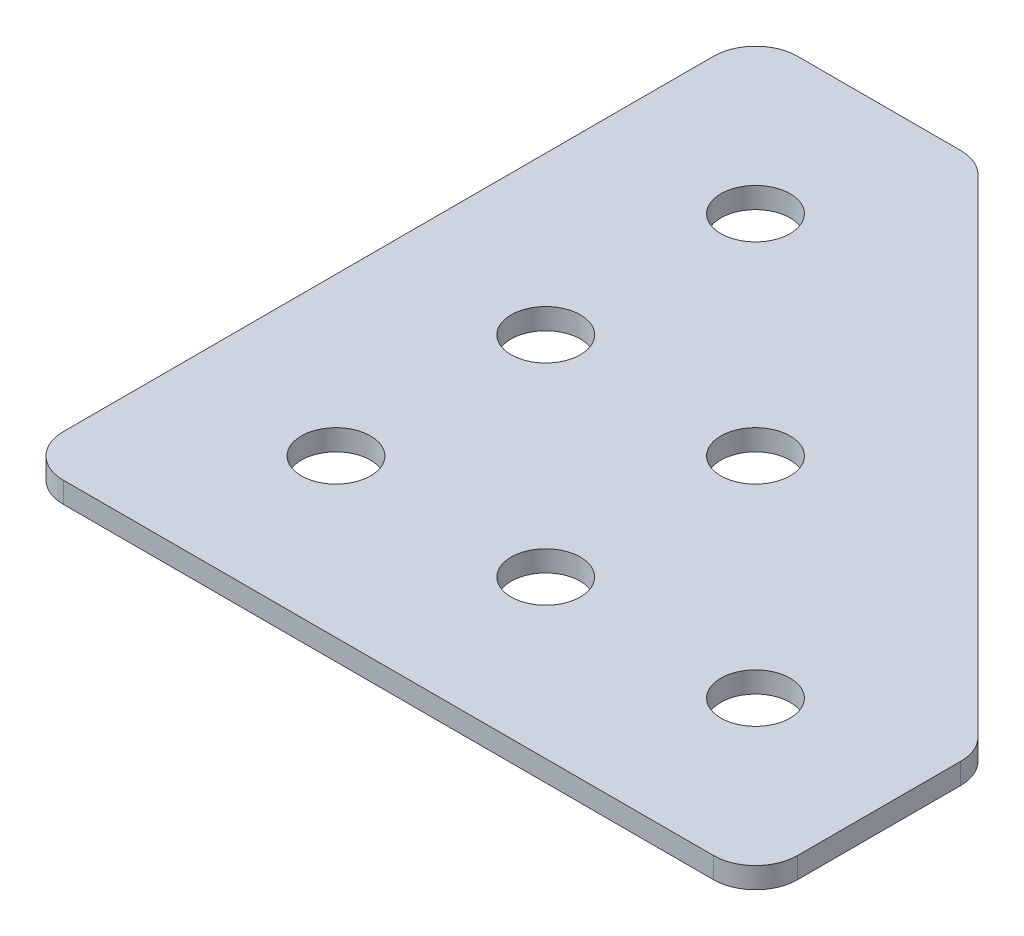
from build123d import *

# Parameters (mm, degrees)
SKETCH1_R           = 1.65
BOSS_EXTRUDE1_DEPTH = 1


with BuildPart() as part:
    # Sketch1 → Boss-Extrude1 (new body)
    with BuildSketch(Plane(origin=(0, 0, 0), x_dir=(1, 0, 0), z_dir=(0, 1, 0))):
        with BuildLine():
            Line((0, 2), (0, 33))
            ThreePointArc((0, 33), (0.585786438, 34.414213562), (2, 35))
            Line((2, 35), (9.778174593, 35))
            ThreePointArc((9.778174593, 35), (10.543541458, 34.847759065), (11.192388155, 34.414213562))
            Line((11.192388155, 34.414213562), (34.414213562, 11.192388155))
            ThreePointArc((34.414213562, 11.192388155), (34.847759065, 10.543541458), (35, 9.778174593))
            Line((35, 9.778174593), (35, 2))
            ThreePointArc((35, 2), (34.414213562, 0.585786438), (33, 0))
            Line((33, 0), (2, 0))
            ThreePointArc((2, 0), (0.585786438, 0.585786438), (0, 2))
        make_face()
        with Locations((7.5, 7.5)):
            Circle(SKETCH1_R, mode=Mode.SUBTRACT)
        with Locations((7.5, 27.5)):
            Circle(SKETCH1_R, mode=Mode.SUBTRACT)
        with Locations((17.5, 7.5)):
            Circle(SKETCH1_R, mode=Mode.SUBTRACT)
        with Locations((27.5, 7.5)):
            Circle(SKETCH1_R, mode=Mode.SUBTRACT)
        with Locations((7.5, 17.5)):
            Circle(SKETCH1_R, mode=Mode.SUBTRACT)
        with Locations((17.5, 17.5)):
            Circle(SKETCH1_R, mode=Mode.SUBTRACT)
    extrude(amount=BOSS_EXTRUDE1_DEPTH)


solid = part.part
